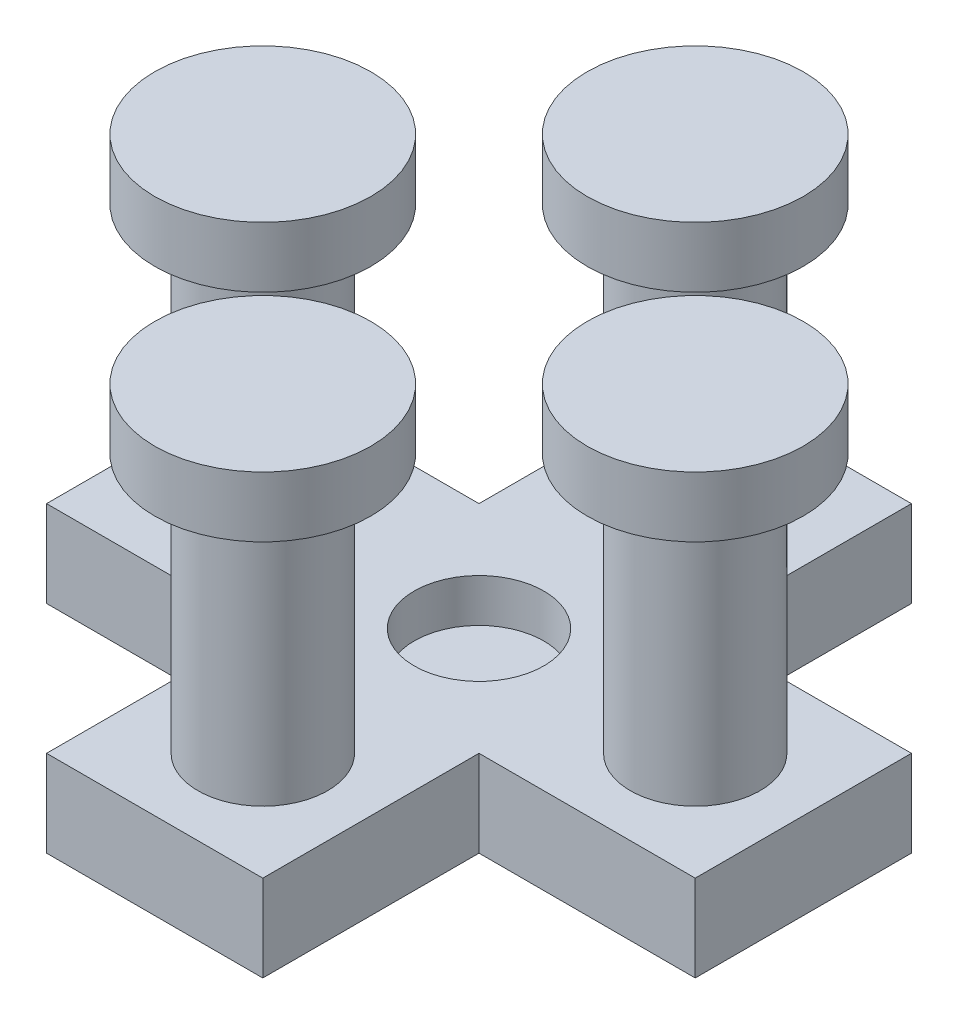
from build123d import *

# Parameters (mm, degrees)
BODY_DEPTH        = 2.54
SKETCH2_R         = 1.905
FLAG_DEPTH        = 7.62
SKETCH3_R         = 3.175
FEET_DEPTH        = 1.778
SKETCH4_R         = 1.905
SPRING_HOLE_DEPTH = 1.27


with BuildPart() as part:
    # Sketch1 → body (new body)
    with BuildSketch(Plane(origin=(0, 0, 0), x_dir=(1, 0, 0), z_dir=(0, 1, 0))):
        Polygon((-8.348684361, -10.452067183), (-8.348684361, -4.102067183), (-1.998684361, -4.102067183), (-1.998684361, -10.452067183), (4.351315639, -10.452067183), (4.351315639, -16.802067183), (-1.998684361, -16.802067183), (-1.998684361, -23.152067183), (-8.348684361, -23.152067183), (-8.348684361, -16.802067183), (-14.698684361, -16.802067183), (-14.698684361, -10.452067183), align=None)
    extrude(amount=BODY_DEPTH)

    # Sketch2 → flag (add)
    with BuildSketch(Plane(origin=(0, 2.54, 0), x_dir=(1, 0, 0), z_dir=(0, 1, 0))):
        with Locations((-5.173684361, -7.277067183)):
            Circle(SKETCH2_R)
        with Locations((1.176315639, -13.627067183)):
            Circle(SKETCH2_R)
        with Locations((-5.173684361, -19.977067183)):
            Circle(SKETCH2_R)
        with Locations((-11.523684361, -13.627067183)):
            Circle(SKETCH2_R)
    extrude(amount=FLAG_DEPTH)

    # Sketch3 → feet (add)
    with BuildSketch(Plane(origin=(0, 10.16, 0), x_dir=(1, 0, 0), z_dir=(0, 1, 0))):
        with Locations((-5.173684361, -7.277067183)):
            Circle(SKETCH3_R)
        with Locations((-11.523684361, -13.627067183)):
            Circle(SKETCH3_R)
        with Locations((-5.173684361, -19.977067183)):
            Circle(SKETCH3_R)
        with Locations((1.176315639, -13.627067183)):
            Circle(SKETCH3_R)
    extrude(amount=FEET_DEPTH)

    # Sketch4 → spring hole (cut)
    with BuildSketch(Plane(origin=(0, 2.54, 0), x_dir=(1, 0, 0), z_dir=(0, 1, 0))):
        with Locations((-5.173684361, -13.627067183)):
            Circle(SKETCH4_R)
    extrude(amount=-SPRING_HOLE_DEPTH, mode=Mode.SUBTRACT)


solid = part.part
